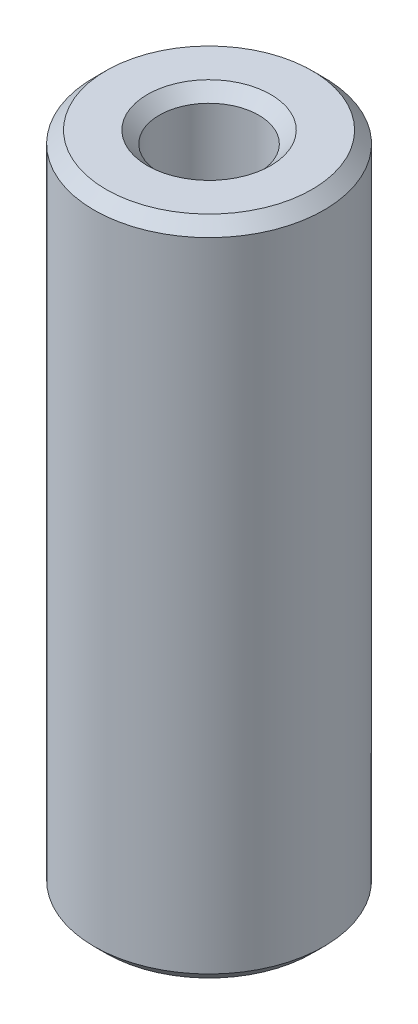
from build123d import *

# Parameters (mm, degrees)
SKETCH1_R           = 22.5
BOSS_EXTRUDE1_DEPTH = 129.570767045
SKETCH2_R           = 9.739730834
CUT_EXTRUDE1_DEPTH  = 134.420701814
CHAMFER1_SIZE       = 2.339726046


with BuildPart() as part:
    # Sketch1 → Boss-Extrude1 (new body)
    with BuildSketch(Plane(origin=(0, 0, 0), x_dir=(1, 0, 0), z_dir=(0, 1, 0))):
        Circle(SKETCH1_R)
    extrude(amount=BOSS_EXTRUDE1_DEPTH)

    # Sketch2 → Cut-Extrude1 (cut, through all)
    with BuildSketch(Plane(origin=(0, 0, 0), x_dir=(1, 0, 0), z_dir=(0, 1, 0))):
        Circle(SKETCH2_R)
    extrude(amount=CUT_EXTRUDE1_DEPTH, mode=Mode.SUBTRACT)

    # Chamfer1
    chamfer1_edges = [part.edges().sort_by_distance(p)[0] for p in [
        (-9.739730834, 129.570767045, 0),
        (-9.739730834, 0, 0),
        (-22.5, 0, 0),
        (-22.5, 129.570767045, 0),
    ]]
    chamfer(chamfer1_edges, length=CHAMFER1_SIZE)


solid = part.part
